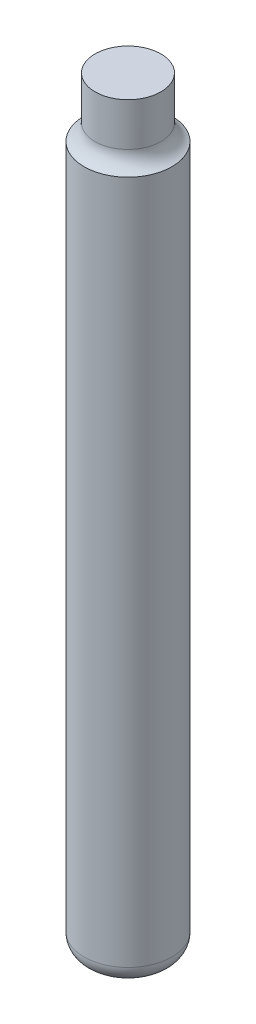
from build123d import *

# Parameters (mm, degrees)
SKETCH1_R           = 3.175
BOSS_EXTRUDE1_DEPTH = 50.8
FILLET1_R           = 1.27
SKETCH4_R           = 2.38125
FILLET2_R           = 1.27


with BuildPart() as part:
    # Sketch1 → Boss-Extrude1 (new body)
    with BuildSketch(Plane(origin=(0, 0, 0), x_dir=(1, 0, 0), z_dir=(0, 1, 0))):
        with Locations(Location((0, 0, 0), (0, 0, 270))):
            Circle(SKETCH1_R)
    extrude(amount=BOSS_EXTRUDE1_DEPTH)

    # Fillet1
    fillet1_edges = [part.edges().sort_by_distance(p)[0] for p in [
        (0, 0, -3.175),
    ]]
    fillet(fillet1_edges, radius=FILLET1_R)

    # Sweep1: sweep along a path in Sketch2
    with BuildLine(Plane.XY) as sweep1_path:
        Line((0, 50.8), (0, 55.095962307))
    # Sketch4 → Sweep1 (sweep)
    with BuildSketch(Plane(origin=(0, 50.8, 0), x_dir=(1, 0, 0), z_dir=(0, 1, 0))):
        Circle(SKETCH4_R)
    sweep(path=sweep1_path.line)

    # Fillet2
    # the kernel refuses this fillet: 1.27 mm, written as the material it adds along each edge
    with BuildSketch(Plane(origin=(0, 50.8, 0), x_dir=(1, 0, 0), z_dir=(0, 0, 1))) as fillet2_piece_1:
        with BuildLine():
            CenterArc((3.65125, 1.17732151), FILLET2_R, 180, 67.975687163)
            Line((2.38125, 1.17732151), (2.35585, 1.17732151))
            Line((2.35585, 1.17732151), (2.35585, 0))
            Line((2.35585, 0), (2.38125, -0.0254))
            ThreePointArc((2.38125, -0.0254), (2.778125, -0.0254), (3.165475, -0.02354643))
            Line((3.165475, -0.02354643), (3.175, 0))
        make_face()
    revolve(axis=Axis((0, 50.8, 0), (0, 1, 0)))


solid = part.part
